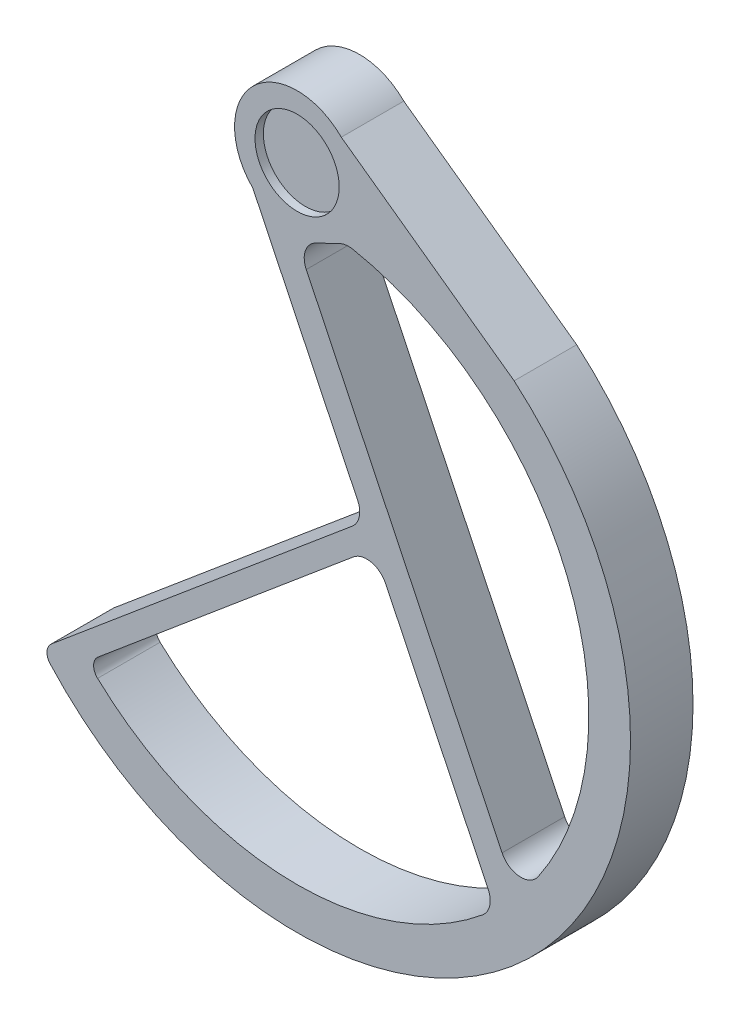
from build123d import *

# Parameters (mm, degrees)
EXTRUDE_1_DEPTH     = 15
CUT_EXTRUDE_START   = -15
CUT_EXTRUDE_1_DEPTH = 15
SKETCH_7_R          = 10.1
CUT_EXTRUDE_2_DEPTH = 2


with BuildPart() as part:
    # ｽｹｯﾁ4 → ﾎﾞｽ - 押し出し1 (new body)
    with BuildSketch(Plane.XY):
        with BuildLine():
            Line((13.244185189, -68.886809092), (-53.623111018, -124.995132678))
            Line((-53.623111018, -124.995132678), (-58.940636287, -129.45706617))
            ThreePointArc((-58.940636287, -129.45706617), (-60.005384698, -131.552012131), (-59.233530865, -133.771635843))
            ThreePointArc((-59.233530865, -133.771635843), (-58.595754044, -134.465930709), (-57.949839695, -135.15266158))
            ThreePointArc((-57.949839695, -135.15266158), (58.01545948, -135.083631519), (52.076178918, -19.270504783))
            Line((52.076178918, -19.270504783), (10.606601718, 10.606601718))
            ThreePointArc((10.606601718, 10.606601718), (-10.606601718, 10.606601718), (-10.606601718, -10.606601718))
            Line((-10.606601718, -10.606601718), (14.536280154, -62.889638219))
            ThreePointArc((14.536280154, -62.889638219), (14.918089499, -66.109676181), (13.244185189, -68.886809092))
        make_face()
        with BuildLine():
            ThreePointArc((13.511229465, -75.151532228), (17.77869109, -74.092739753), (21.232400696, -76.813798404))
            Line((21.232400696, -76.813798404), (45.844843506, -127.993820346))
            ThreePointArc((45.844843506, -127.993820346), (46.221944165, -131.235480845), (44.518718993, -134.019289696))
            ThreePointArc((44.518718993, -134.019289696), (-2.231208213, -149.964431749), (-47.870174388, -131.072951785))
            ThreePointArc((-47.870174388, -131.072951785), (-48.817477846, -128.802229421), (-47.747678417, -126.586582094))
            Line((-47.747678417, -126.586582094), (13.511229465, -75.151532228))
        make_face(mode=Mode.SUBTRACT)
    extrude(amount=EXTRUDE_1_DEPTH)

    # ｽｹｯﾁ6 → ｶｯﾄ - 押し出し1 (cut)
    with BuildSketch(Plane.XY.offset(15).offset(CUT_EXTRUDE_START)):
        with BuildLine():
            Line((49.189589797, -118.797265215), (2.201751786, -21.089020696))
            ThreePointArc((2.201751786, -21.089020696), (1.989274209, -17.268089629), (4.540836142, -14.416039025))
            Line((4.540836142, -14.416039025), (6.483415605, -13.48185369))
            Line((6.483415605, -13.48185369), (10.219658847, -11.685096486))
            ThreePointArc((10.219658847, -11.685096486), (11.747077013, -11.232198087), (13.339423466, -11.282754846))
            ThreePointArc((13.339423466, -11.282754846), (64.738421392, -53.37413296), (57.826055334, -119.448033215))
            ThreePointArc((57.826055334, -119.448033215), (53.319931874, -121.616182211), (49.189589797, -118.797265215))
        make_face()
    extrude(amount=CUT_EXTRUDE_1_DEPTH, mode=Mode.SUBTRACT)

    # ｽｹｯﾁ7 → ｶｯﾄ - 押し出し2 (cut)
    with BuildSketch(Plane.XY.offset(15)):
        Circle(SKETCH_7_R)
    extrude(amount=-CUT_EXTRUDE_2_DEPTH, mode=Mode.SUBTRACT)


solid = part.part
